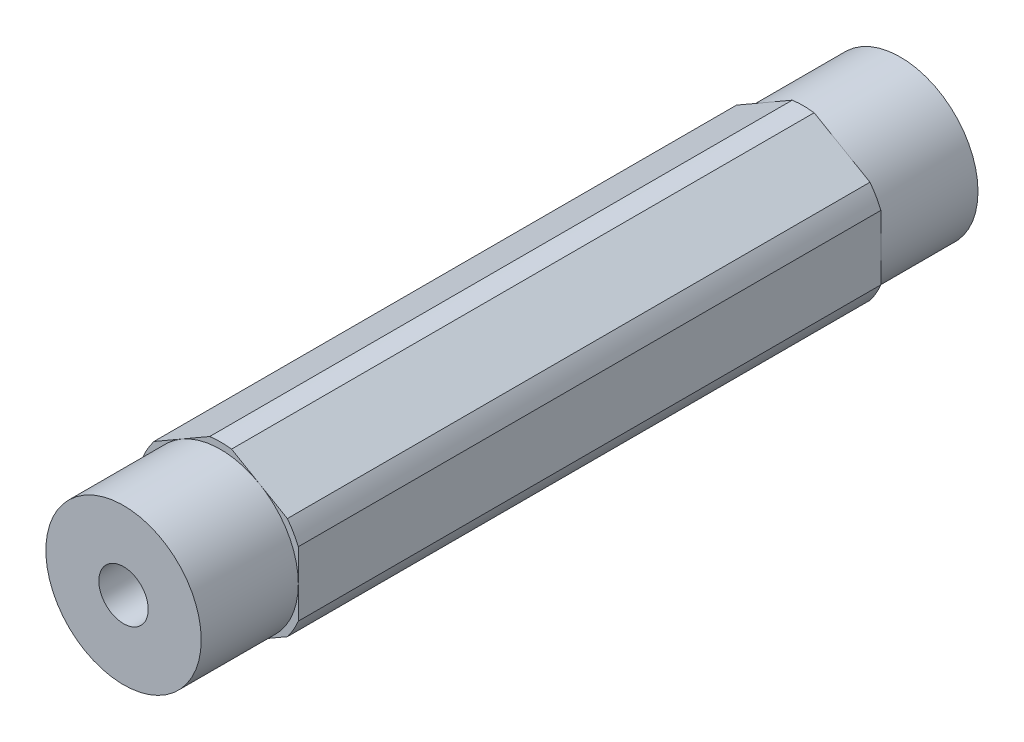
from build123d import *

# Parameters (mm, degrees)
BOSS_EXTRUDE1_DEPTH = 31.75
SKETCH3_R           = 2.0193
CUT_EXTRUDE1_DEPTH  = 65.185965172
SKETCH7_R           = 6.875
SKETCH7_R_2         = 6.35
CUT_EXTRUDE2_DEPTH  = 7.9375


with BuildPart() as part:
    # Sketch1 → Boss-Extrude1 (new, symmetric)
    with BuildSketch(Plane.XY):
        with BuildLine():
            Line((-0.893039494, 6.816751826), (-5.456960506, 4.181770802))
            ThreePointArc((-5.456960506, 4.181770802), (-5.953924651, 3.4375), (-6.35, 2.634981025))
            Line((-6.35, 2.634981025), (-6.35, -2.634981025))
            ThreePointArc((-6.35, -2.634981025), (-5.953924651, -3.4375), (-5.456960506, -4.181770802))
            Line((-5.456960506, -4.181770802), (-0.893039494, -6.816751826))
            ThreePointArc((-0.893039494, -6.816751826), (0, -6.875), (0.893039494, -6.816751826))
            Line((0.893039494, -6.816751826), (5.456960506, -4.181770802))
            ThreePointArc((5.456960506, -4.181770802), (5.953924651, -3.4375), (6.35, -2.634981025))
            Line((6.35, -2.634981025), (6.35, 2.634981025))
            ThreePointArc((6.35, 2.634981025), (5.953924651, 3.4375), (5.456960506, 4.181770802))
            Line((5.456960506, 4.181770802), (0.893039494, 6.816751826))
            ThreePointArc((0.893039494, 6.816751826), (0, 6.875), (-0.893039494, 6.816751826))
        make_face()
    extrude(amount=BOSS_EXTRUDE1_DEPTH, both=True)

    # Sketch3 → Cut-Extrude1 (cut, through all)
    with BuildSketch(Plane.XY.offset(31.75)):
        Circle(SKETCH3_R)
    extrude(amount=-CUT_EXTRUDE1_DEPTH, mode=Mode.SUBTRACT)

    # Sketch7 → Cut-Extrude2 (cut)
    with BuildSketch(Plane.XY.offset(31.75)):
        Circle(SKETCH7_R)
        Circle(SKETCH7_R_2, mode=Mode.SUBTRACT)
    cut_extrude2 = extrude(amount=-CUT_EXTRUDE2_DEPTH, mode=Mode.SUBTRACT)

    # Mirror1: Cut-Extrude2 across plane
    add(cut_extrude2.mirror(Plane.XY), mode=Mode.SUBTRACT)


solid = part.part
